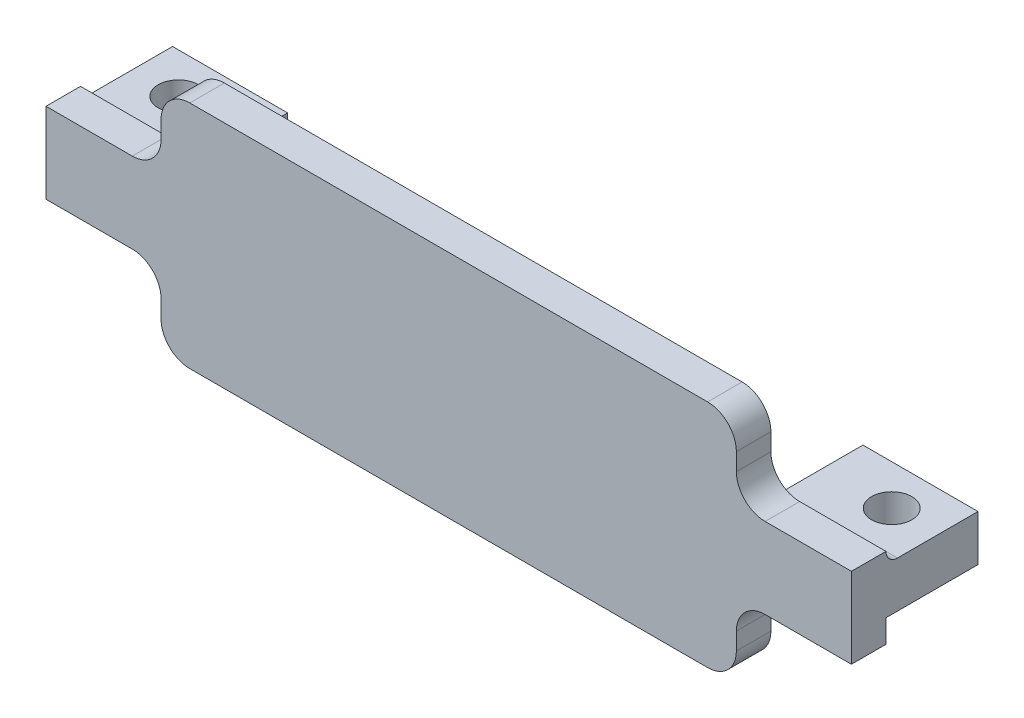
from build123d import *

# Parameters (mm, degrees)
SKETCH1_W           = 20
SKETCH1_H           = 155
BOSS_EXTRUDE1_DEPTH = 4
SKETCH2_W           = 20
SKETCH2_H           = 4
BOSS_EXTRUDE3_DEPTH = 50
RIB2_REACH          = 96.986
SKETCH7_WALL_W      = 290.205463948
SKETCH7_WALL_H      = 4
SKETCH8_W           = 20
SKETCH8_H           = 3
BOSS_EXTRUDE4_DEPTH = 3.5
SKETCH9_W           = 70
SKETCH9_H           = 5
BOSS_EXTRUDE6_DEPTH = 3
SKETCH10_W          = 10
SKETCH10_H          = 4
BOSS_EXTRUDE7_DEPTH = 8
SKETCH12_R          = 1.75
CUT_EXTRUDE1_DEPTH  = 10
SKETCH13_W          = 111.319070758
SKETCH13_H          = 99.743885808
CUT_EXTRUDE2_DEPTH  = 152
SKETCH14_W          = 50
SKETCH14_H          = 3
BOSS_EXTRUDE8_DEPTH = 6.5
FILLET1_R           = 1
FILLET2_R           = 2.5


with BuildPart() as part:
    # Sketch1 → Boss-Extrude1 (new body)
    with BuildSketch(Plane.XY):
        Rectangle(SKETCH1_W, SKETCH1_H)
    extrude(amount=BOSS_EXTRUDE1_DEPTH)

    # Sketch2 → Boss-Extrude3 (add)
    with BuildSketch(Plane.XY.offset(4)):
        with Locations((0, -75.5)):
            Rectangle(SKETCH2_W, SKETCH2_H)
    extrude(amount=BOSS_EXTRUDE3_DEPTH)

    # Sketch7 wall → Rib2 (add, up to next)
    with BuildSketch(Plane(origin=(0, -26, 16.5), x_dir=(0, 0.967074537263, -0.25449329928), z_dir=(0, 0.25449329928, 0.967074537263)), mode=Mode.PRIVATE) as rib2_sk1:
        Rectangle(SKETCH7_WALL_W, SKETCH7_WALL_H)
    rib2_tool1 = extrude(rib2_sk1.sketch, amount=-RIB2_REACH, mode=Mode.PRIVATE) - part.part
    add(rib2_tool1.solids().sort_by_distance((0, -26, 16.5))[0])

    # Sketch8 → Boss-Extrude4 (add)
    with BuildSketch(Plane.XY.offset(4)):
        with Locations((0, 76)):
            Rectangle(SKETCH8_W, SKETCH8_H)
    extrude(amount=BOSS_EXTRUDE4_DEPTH)

    # Sketch9 → Boss-Extrude6 (add)
    with BuildSketch(Plane.XY.offset(7.5)):
        with Locations((0, 77)):
            Rectangle(SKETCH9_W, SKETCH9_H)
    boss_extrude6 = extrude(amount=BOSS_EXTRUDE6_DEPTH)

    # Sketch10 → Boss-Extrude7 (add)
    with BuildSketch(Plane(origin=(0, 0, 7.5), x_dir=(-1, 0, 0), z_dir=(0, 0, -1))):
        with Locations((30, 76.5)):
            Rectangle(SKETCH10_W, SKETCH10_H)
        with Locations((-30, 76.5)):
            Rectangle(SKETCH10_W, SKETCH10_H)
    extrude(amount=BOSS_EXTRUDE7_DEPTH)

    # Sketch12 → Cut-Extrude1 (cut)
    with BuildSketch(Plane(origin=(0, 78.5, 0), x_dir=(1, 0, 0), z_dir=(0, 1, 0))):
        with Locations(Location((-31, -3, 0), (0, 0, 270))):
            Circle(SKETCH12_R)
        with Locations(Location((31, -3, 0), (0, 0, 270))):
            Circle(SKETCH12_R)
    extrude(amount=-CUT_EXTRUDE1_DEPTH, mode=Mode.SUBTRACT)

    # Sketch13 → Cut-Extrude2 (cut)
    with BuildSketch(Plane.XZ.offset(77.5)):
        with Locations((2.652852139, 20.474703111)):
            Rectangle(SKETCH13_W, SKETCH13_H)
    extrude(amount=-CUT_EXTRUDE2_DEPTH, mode=Mode.SUBTRACT)

    # Sketch14 → Boss-Extrude8 (add)
    with BuildSketch(Plane(origin=(0, 79.5, 0), x_dir=(1, 0, 0), z_dir=(0, 1, 0))):
        with Locations((0, -9)):
            Rectangle(SKETCH14_W, SKETCH14_H)
    boss_extrude8 = extrude(amount=BOSS_EXTRUDE8_DEPTH)

    # Mirror1: Boss-Extrude6, Boss-Extrude8 across plane
    add(boss_extrude6.mirror(Plane(origin=(0, 76, 0), x_dir=(0, 0, 1), z_dir=(0, -1, 0))))
    add(boss_extrude8.mirror(Plane(origin=(0, 76, 0), x_dir=(0, 0, 1), z_dir=(0, -1, 0))))

    # Fillet1
    fillet1_edges = [part.edges().sort_by_distance(p)[0] for p in [
        (10, 76, 7.5),
        (0, 77.5, 7.5),
        (-10, 76, 7.5),
        (-30, 78.5, 7.5),
        (-25, 76.5, 7.5),
        (25, 76.5, 7.5),
        (30, 78.5, 7.5),
    ]]
    fillet(fillet1_edges, radius=FILLET1_R - 0.0001)  # a hair under: the kernel refuses the full size

    # Fillet2
    fillet2_edges = [part.edges().sort_by_distance(p)[0] for p in [
        (-25, 79.5, 9),
        (25, 79.5, 9),
        (-25, 86, 9),
        (25, 86, 9),
        (-25, 66, 9),
        (25, 66, 9),
        (-25, 72.5, 9),
        (25, 72.5, 9),
    ]]
    fillet(fillet2_edges, radius=FILLET2_R)


solid = part.part
